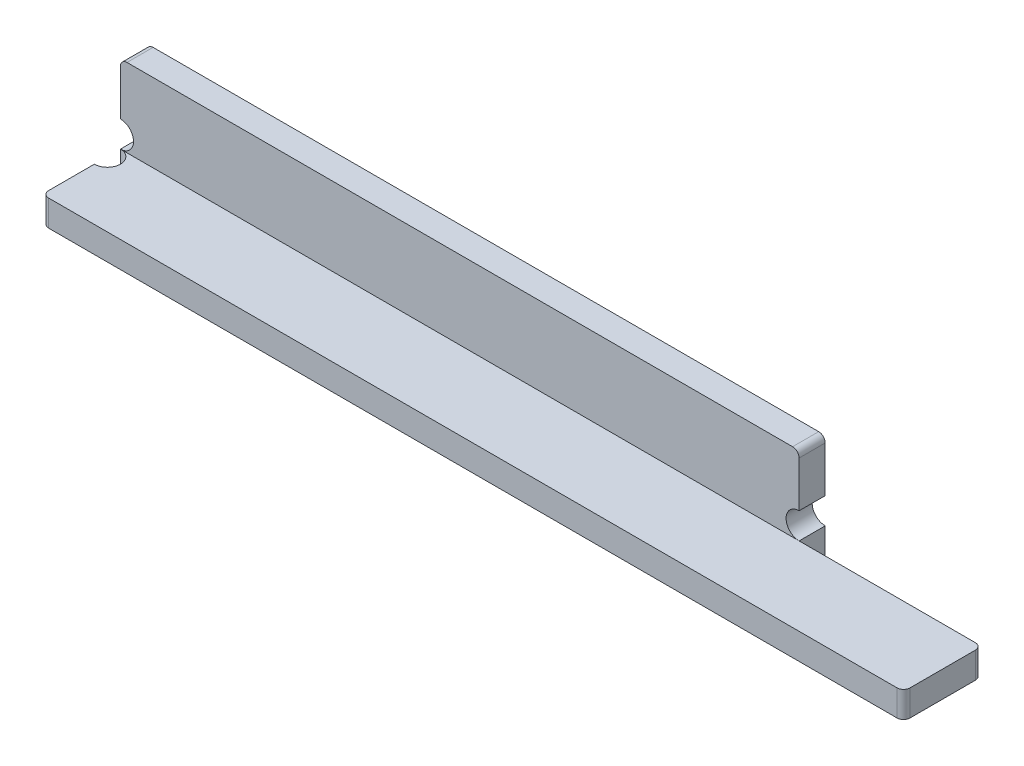
from build123d import *

# Parameters (mm, degrees)
BASE_DEPTH                = 5
SKETCH2_W                 = 130
SKETCH2_H                 = 5
MIDDLE_EXTRUSION_DEPTH    = 15
FANCY_CUTOUT_DEPTH        = 167.602070815
FANCY_CUTOUT_MIDDLE_DEPTH = 168.406690428
OVERALL_FILLETS_R         = 1.25


with BuildPart() as part:
    # Sketch1 → base (new body)
    with BuildSketch(Plane(origin=(0, 0, 0), x_dir=(1, 0, 0), z_dir=(0, 1, 0))):
        Polygon((0, 0), (0, 17.5), (86, 17.5), (86, 2.5), (130, 2.5), (130, -2.5), (165, -2.5), (165, -17.5), (0, -17.5), align=None)
    extrude(amount=BASE_DEPTH)

    # Sketch2 → middle_extrusion (add)
    with BuildSketch(Plane(origin=(0, 5, 0), x_dir=(1, 0, 0), z_dir=(0, 1, 0))):
        with Locations((65, 0)):
            Rectangle(SKETCH2_W, SKETCH2_H)
    extrude(amount=MIDDLE_EXTRUSION_DEPTH)

    # Sketch3 → fancy_cutout (cut, through all)
    with BuildSketch(Plane(origin=(0, 5, 0), x_dir=(1, 0, 0), z_dir=(0, 1, 0))):
        with BuildLine():
            Line((0, -7.5), (0, -2.5))
            ThreePointArc((0, -2.5), (2.5, -5), (0, -7.5))
        make_face()
        with BuildLine():
            Line((0, 2.5), (0, 7.5))
            ThreePointArc((0, 7.5), (2.5, 5), (0, 2.5))
        make_face()
        with BuildLine():
            Line((86, 2.5), (86, 7.5))
            ThreePointArc((86, 7.5), (83.5, 5), (86, 2.5))
        make_face()
    extrude(amount=-FANCY_CUTOUT_DEPTH, mode=Mode.SUBTRACT)

    # Sketch4 → fancy_cutout_middle (cut, through all)
    with BuildSketch(Plane.XY.offset(2.5)):
        with BuildLine():
            Line((0, 5), (0, 10))
            ThreePointArc((0, 10), (2.5, 7.5), (0, 5))
        make_face()
        with BuildLine():
            Line((130, 5), (130, 10))
            ThreePointArc((130, 10), (127.5, 7.5), (130, 5))
        make_face()
    extrude(amount=-FANCY_CUTOUT_MIDDLE_DEPTH, mode=Mode.SUBTRACT)

    # overall_fillets
    overall_fillets_edges = [part.edges().sort_by_distance(p)[0] for p in [
        (0, 2.5, 17.5),
        (165, 2.5, 17.5),
        (165, 2.5, 2.5),
        (130, 20, 0),
        (0, 20, 0),
        (86, 2.5, -17.5),
        (0, 2.5, -17.5),
    ]]
    fillet(overall_fillets_edges, radius=OVERALL_FILLETS_R)


solid = part.part
